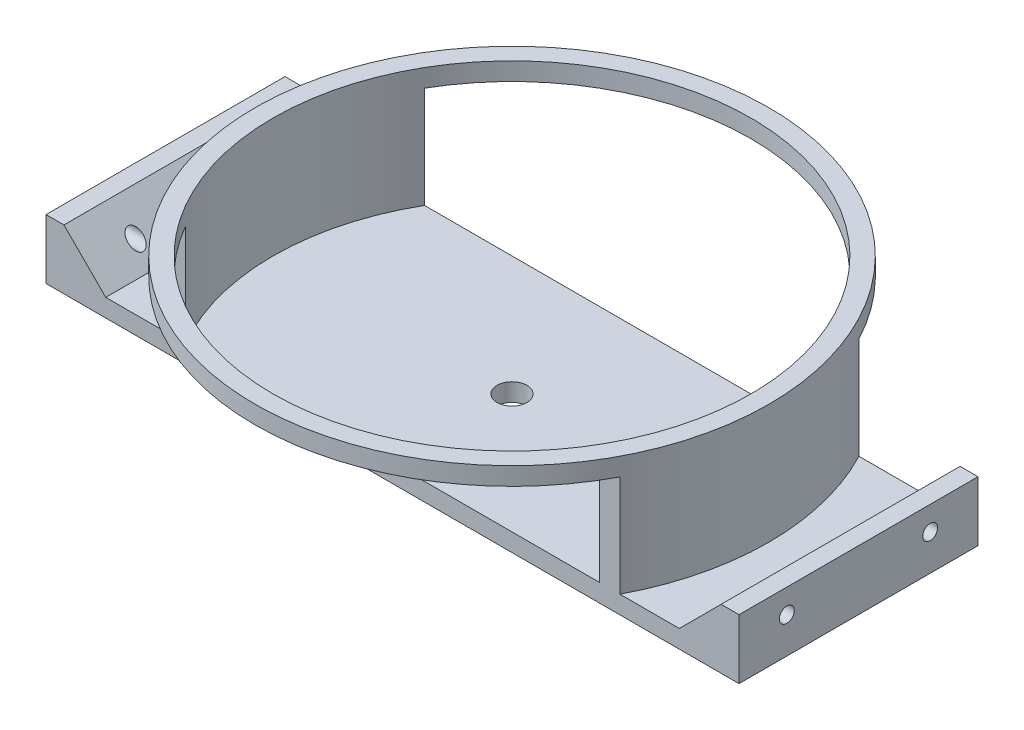
from build123d import *
from build123d.topology import SkipClean

# Parameters (mm, degrees)
SKETCH_1_W               = 116
SKETCH_1_H               = 40
EXTRUDE_1_DEPTH          = 3
SKETCH_2_R               = 2.5
CUT_EXTRUDE_1_DEPTH      = 3
SKETCH_3_W               = 3
SKETCH_3_H               = 40
EXTRUDE_2_DEPTH          = 7
CHAMFER_1_SIZE           = 7
CUT_EXTRUDE_2_DEPTH      = 119.135515405
CUT_EXTRUDE_2_DEPTH_BACK = 119.135515405
SKETCH_4_R               = 1.25
SKETCH_6_R               = 43
SKETCH_6_R_2             = 40
EXTRUDE_1_2_DEPTH        = 3
EXTRUDE_3_DEPTH          = 17


with BuildPart() as part:
    # 草图1 → Extrude 1 (new body)
    with BuildSketch(Plane(origin=(0, 0, 0), x_dir=(1, 0, 0), z_dir=(0, 1, 0))):
        Rectangle(SKETCH_1_W, SKETCH_1_H)
    extrude(amount=EXTRUDE_1_DEPTH)

    # 草图2 → 切除-拉伸1 (cut)
    with BuildSketch(Plane(origin=(0, 3, 0), x_dir=(1, 0, 0), z_dir=(0, 1, 0))):
        with Locations(Location((0, 0, 0), (0, 0, 270))):
            Circle(SKETCH_2_R)
    extrude(amount=-CUT_EXTRUDE_1_DEPTH, mode=Mode.SUBTRACT)

    # 草图3 → 凸台-拉伸2 (add)
    with BuildSketch(Plane(origin=(0, 3, 0), x_dir=(1, 0, 0), z_dir=(0, 1, 0))):
        with Locations((-56.5, 0)):
            Rectangle(SKETCH_3_W, SKETCH_3_H)
        with Locations((56.5, 0)):
            Rectangle(SKETCH_3_W, SKETCH_3_H)
    extrude(amount=EXTRUDE_2_DEPTH)

    # 倒角1
    chamfer_1_edges = [part.edges().sort_by_distance(p)[0] for p in [
        (-55, 3, 0),
        (55, 3, 0),
    ]]
    chamfer(chamfer_1_edges, length=CHAMFER_1_SIZE - 0.0001)  # a hair under: the kernel refuses the full size

    # 草图4 → 切除-拉伸2 (cut, two sides: drawn at the far end of the back side and taken through both)
    with BuildSketch(Plane.ZY.offset(58).offset(-CUT_EXTRUDE_2_DEPTH_BACK)):
        with Locations((-12, 6)):
            Circle(SKETCH_4_R)
        with Locations((12, 6)):
            Circle(SKETCH_4_R)
    extrude(amount=CUT_EXTRUDE_2_DEPTH + CUT_EXTRUDE_2_DEPTH_BACK, mode=Mode.SUBTRACT)



with BuildPart() as body_2:
    # 草图6 → Extrude 1 2 (new body)
    with BuildSketch(Plane(origin=(0, 23, 0), x_dir=(1, 0, 0), z_dir=(0, 1, 0))):
        Circle(SKETCH_6_R)
        Circle(SKETCH_6_R_2, mode=Mode.SUBTRACT)
    extrude(amount=-EXTRUDE_1_2_DEPTH)


with BuildPart() as part_1:
    with SkipClean():  # the faces are left unmerged after this step: merging them gives an invalid solid
        add(part.part)

        add(body_2.part)  # 凸台-拉伸3 merges body 2
        # 草图7 → 凸台-拉伸3 (add)
        with BuildSketch(Plane(origin=(0, 3, 0), x_dir=(1, 0, 0), z_dir=(0, 1, 0))):
            with BuildLine():
                Line((-34.641016151, 20), (-38.065732621, 20))
                ThreePointArc((-38.065732621, 20), (-43, 0), (-38.065732621, -20))
                Line((-38.065732621, -20), (-34.641016151, -20))
                ThreePointArc((-34.641016151, -20), (-40, 0), (-34.641016151, 20))
            make_face()
            with BuildLine():
                ThreePointArc((43, 0), (41.748212553, 10.299842166), (38.065732621, 20))
                Line((38.065732621, 20), (34.641016151, 20))
                ThreePointArc((34.641016151, 20), (38.637033052, 10.352761804), (40, 0))
                ThreePointArc((40, 0), (38.637033052, -10.352761804), (34.641016151, -20))
                Line((34.641016151, -20), (38.065732621, -20))
                ThreePointArc((38.065732621, -20), (41.748212553, -10.299842166), (43, 0))
            make_face()
        extrude(amount=EXTRUDE_3_DEPTH)


solid = part_1.part
